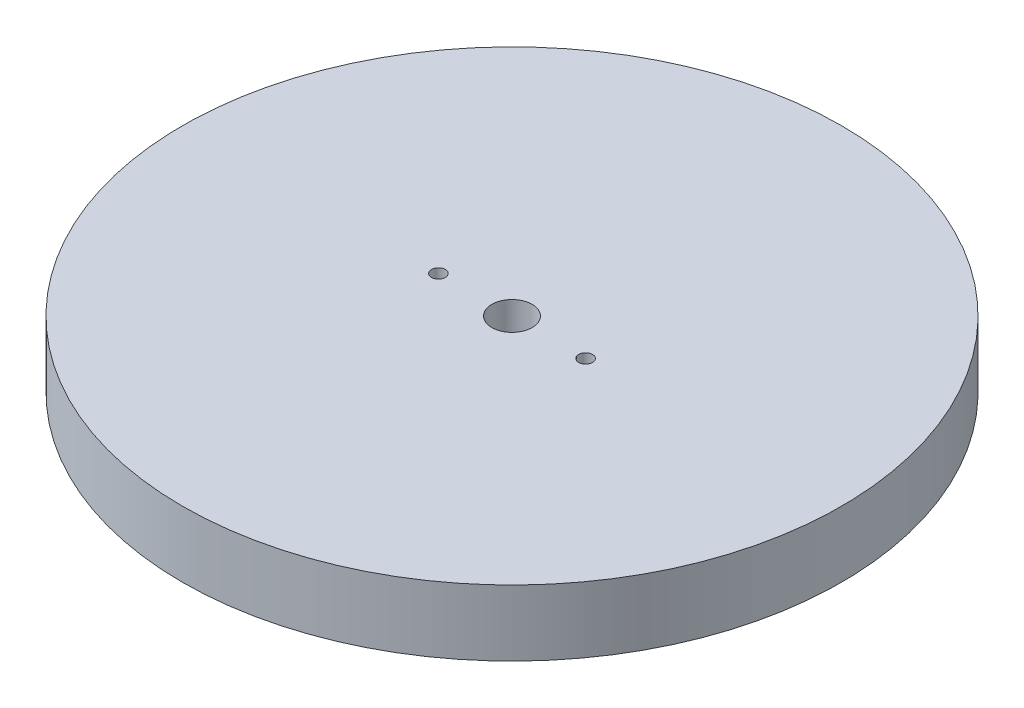
from build123d import *

# Parameters (mm, degrees)
SKETCH1_R           = 45
SKETCH1_R_2         = 2.75
SKETCH1_R_3         = 0.95
BOSS_EXTRUDE1_DEPTH = 9


with BuildPart() as part:
    # Sketch1 → Boss-Extrude1 (new body)
    with BuildSketch(Plane(origin=(0, 0, 0), x_dir=(1, 0, 0), z_dir=(0, 1, 0))):
        with Locations((-29.43350584, -19.145341983)):
            Circle(SKETCH1_R)
        with Locations((-29.43350584, -19.145341983)):
            Circle(SKETCH1_R_2, mode=Mode.SUBTRACT)
        with Locations((-39.48350584, -19.145341983)):
            Circle(SKETCH1_R_3, mode=Mode.SUBTRACT)
        with Locations((-19.38350584, -19.145341983)):
            Circle(SKETCH1_R_3, mode=Mode.SUBTRACT)
    extrude(amount=BOSS_EXTRUDE1_DEPTH)


solid = part.part
